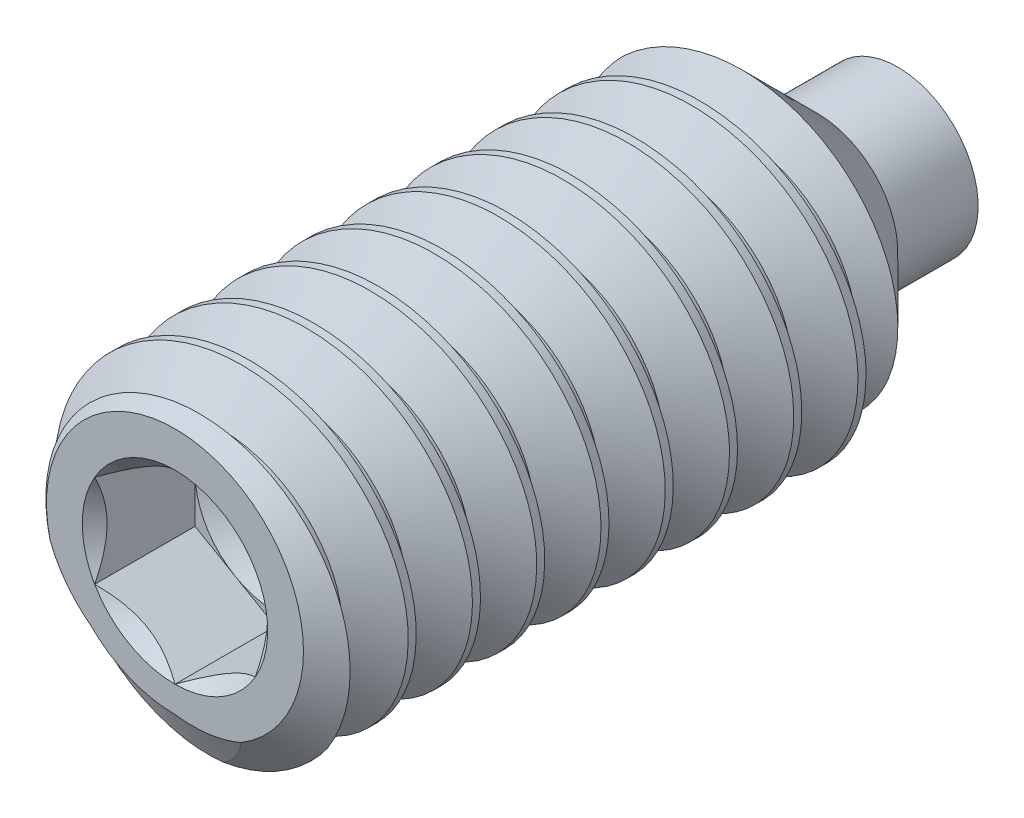
from build123d import *

# Parameters (mm, degrees)
CUT_SWEEP2_PITCH    = 1.27
CUT_EXTRUDE10_DEPTH = 1.984375


with BuildPart() as part:
    # Sketch22 → Revolve1 (revolve)
    with BuildSketch(Plane(origin=(0, 0, 0), x_dir=(0, 0, -1), z_dir=(1, 0, 0)), mode=Mode.PRIVATE) as revolve1_sk:
        Polygon((-7.14375, 0), (-7.14375, 2.54), (-6.699118213, 3.175), (3.96875, 3.175), (5.55625, 1.5875), (7.14375, 1.5875), (7.14375, 0), align=None)
    revolve(revolve1_sk.sketch.rotate(Axis((0, 0, -7.14375), (0, 0, 1)), 90), axis=Axis((0, 0, -7.14375), (0, 0, 1)))

    # Cut-Sweep2: the profile of Sketch28 profile screwed along a right-hand helix of 12 turns, 8 arcs to a turn; built about Z, then put on its axis
    cut_sweep2_z = Axis((0, 0, 0), (0, 0, 1))
    cut_sweep2_corners = [(3.1753, 0, 0.000173205), (3.1753, 0, -1.111423205), (2.350110803, 0, -0.635), (2.350110803, 0, -0.47625)]
    with BuildLine(mode=Mode.PRIVATE) as cut_sweep2_profile:
        Line(cut_sweep2_corners[0], cut_sweep2_corners[1])
        Line(cut_sweep2_corners[1], cut_sweep2_corners[2])
        Line(cut_sweep2_corners[2], cut_sweep2_corners[3])
        Line(cut_sweep2_corners[3], cut_sweep2_corners[0])
    cut_sweep2_cap = Face(cut_sweep2_profile.wire())
    cut_sweep2_turn_angles = [0, 22.5, 45, 67.5, 90, 112.5, 135, 157.5, 180, 202.5, 225, 247.5, 270, 292.5, 315, 337.5, 360]
    cut_sweep2_turn_weights = [1, 0.9238795325112867, 1, 0.9238795325112867, 1, 0.9238795325112867, 1, 0.9238795325112867, 1, 0.9238795325112867, 1, 0.9238795325112867, 1, 0.9238795325112867, 1, 0.9238795325112867, 1]
    cut_sweep2_turn_rails = [Edge.make_bspline([Vector(p[0], p[1], 0).rotate(cut_sweep2_z, cut_sweep2_turn_angles[k]) / cut_sweep2_turn_weights[k] + Vector(0, 0, p[2] + CUT_SWEEP2_PITCH * cut_sweep2_turn_angles[k] / 360) for k in range(17)], [0, 0, 0, 1, 1, 2, 2, 3, 3, 4, 4, 5, 5, 6, 6, 7, 7, 8, 8, 8], 2, cut_sweep2_turn_weights) for p in cut_sweep2_corners]
    cut_sweep2_turn_sides = [Face.make_surface_from_curves(cut_sweep2_turn_rails[p[0]], cut_sweep2_turn_rails[p[1]]) for p in [(0, 1), (1, 2), (2, 3), (3, 0)]]
    cut_sweep2 = Plane(origin=(0, 0, -5.55625), x_dir=(0, 1, 0), z_dir=(0, 0, 1)) * Solid(Shell([*[p.moved(Location((0, 0, CUT_SWEEP2_PITCH * i))) for i in range(12) for p in cut_sweep2_turn_sides], cut_sweep2_cap, cut_sweep2_cap.rotate(cut_sweep2_z, 4320).moved(Location((0, 0, CUT_SWEEP2_PITCH * 4320 / 360)))]))
    add(cut_sweep2, mode=Mode.SUBTRACT)

    # Sketch23 → Cut-Extrude10 (cut)
    with BuildSketch(Plane.XY.offset(7.14375)):
        Polygon((0, 1.833087105), (-1.5875, 0.916543552), (-1.5875, -0.916543552), (0, -1.833087105), (1.5875, -0.916543552), (1.5875, 0.916543552), align=None)
    extrude(amount=-CUT_EXTRUDE10_DEPTH, mode=Mode.SUBTRACT)

    # Cut-Extrude11 cone 1 section (through the dimple's axis) → Cut-Extrude11 (revolve, cut)
    with BuildSketch(Plane(origin=(0, 0, 7.14375), x_dir=(0, -1, 0), z_dir=(1, 0, 0))):
        Polygon((0, 0), (1.833087105, 0), (0, 1.833087105), align=None)
    revolve(axis=Axis((0, 0, 7.14375), (0, 0, -1)), mode=Mode.SUBTRACT)

    # Cut-Extrude12 cone 1 section (through the dimple's axis) → Cut-Extrude12 (revolve, cut)
    with BuildSketch(Plane(origin=(0, 0, 5.159375), x_dir=(0, -1, 0), z_dir=(1, 0, 0))):
        Polygon((0, 0), (1.5875, 0), (0, 0.916543552), align=None)
    revolve(axis=Axis((0, 0, 5.159375), (0, 0, -1)), mode=Mode.SUBTRACT)


solid = part.part
